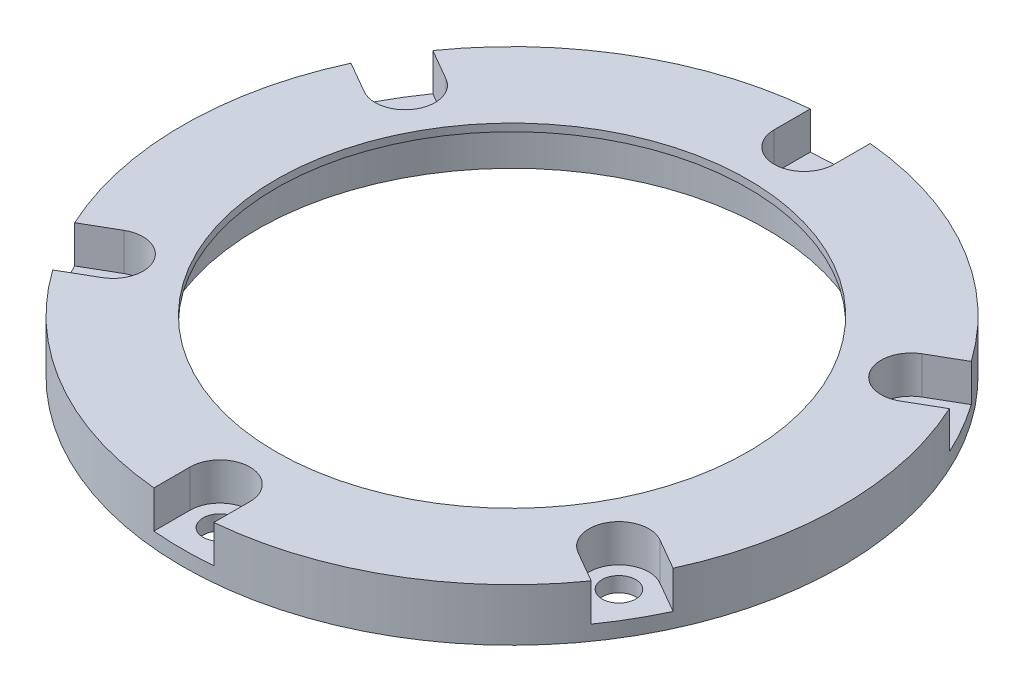
from build123d import *

# Parameters (mm, degrees)
SKETCH_1_R                   = 44
SKETCH_1_R_2                 = 34
EXTRUDE_1_DEPTH              = 6
SKETCH_2_R                   = 44
SKETCH_2_R_2                 = 31.5
EXTRUDE_2_DEPTH              = 1
HOLE_WIZARD_M4_1_D           = 4.5
HOLE_WIZARD_M4_1_CBORE_D     = 8
HOLE_WIZARD_M4_1_CBORE_DEPTH = 5
PATTERN_CIRCULAR_1_COUNT     = 6
FILLET_1_R                   = 0.3
CUT_EXTRUDE_1_DEPTH          = 5
PATTERN_CIRCULAR_2_COUNT     = 6


with BuildPart() as part:
    # 스케치1 → 보스-돌출1 (new body)
    with BuildSketch(Plane(origin=(0, 0, 0), x_dir=(1, 0, 0), z_dir=(0, 1, 0))):
        Circle(SKETCH_1_R)
        Circle(SKETCH_1_R_2, mode=Mode.SUBTRACT)
    extrude(amount=EXTRUDE_1_DEPTH)

    # 스케치2 → 보스-돌출2 (add)
    with BuildSketch(Plane(origin=(0, 6, 0), x_dir=(1, 0, 0), z_dir=(0, 1, 0))):
        Circle(SKETCH_2_R)
        Circle(SKETCH_2_R_2, mode=Mode.SUBTRACT)
    extrude(amount=EXTRUDE_2_DEPTH)

    # M4 육각 소켓 머리 캡 나사용 카운터보어1 (through all)
    with Locations(Plane(origin=(0, 7, 0), x_dir=(1, 0, 0), z_dir=(0, 1, 0))):
        with Locations((0, 39)):
            hole_wizard_m4_1 = CounterBoreHole(HOLE_WIZARD_M4_1_D / 2, HOLE_WIZARD_M4_1_CBORE_D / 2, HOLE_WIZARD_M4_1_CBORE_DEPTH)

    # 원형 패턴1: M4 육각 소켓 머리 캡 나사용 카운터보어1 ×6 about axis
    pattern_circular_1_axis = Axis((0, 6, 0), (0, -1, 0))
    for i in range(1, PATTERN_CIRCULAR_1_COUNT):
        add(hole_wizard_m4_1.rotate(pattern_circular_1_axis, i * 360 / PATTERN_CIRCULAR_1_COUNT), mode=Mode.SUBTRACT)

    # 필렛1
    fillet_1_edges = [part.edges().sort_by_distance(p)[0] for p in [
        (-34, 6, 0),
    ]]
    fillet(fillet_1_edges, radius=FILLET_1_R)

    # 스케치7 → 컷-돌출1 (cut, symmetric)
    with BuildSketch(Plane(origin=(0, 7, 0), x_dir=(1, 0, 0), z_dir=(0, 1, 0))):
        with BuildLine():
            Line((-4, 39), (-4, 44))
            Line((-4, 44), (4, 44))
            Line((4, 44), (4, 39))
            ThreePointArc((4, 39), (0, 43), (-4, 39))
        make_face()
    cut_extrude_1 = extrude(amount=CUT_EXTRUDE_1_DEPTH, both=True, mode=Mode.SUBTRACT)

    # 원형 패턴2: 컷-돌출1 ×6 about axis
    pattern_circular_2_axis = Axis((0, 6, 0), (0, -1, 0))
    for i in range(1, PATTERN_CIRCULAR_2_COUNT):
        add(cut_extrude_1.rotate(pattern_circular_2_axis, i * 360 / PATTERN_CIRCULAR_2_COUNT), mode=Mode.SUBTRACT)


solid = part.part
